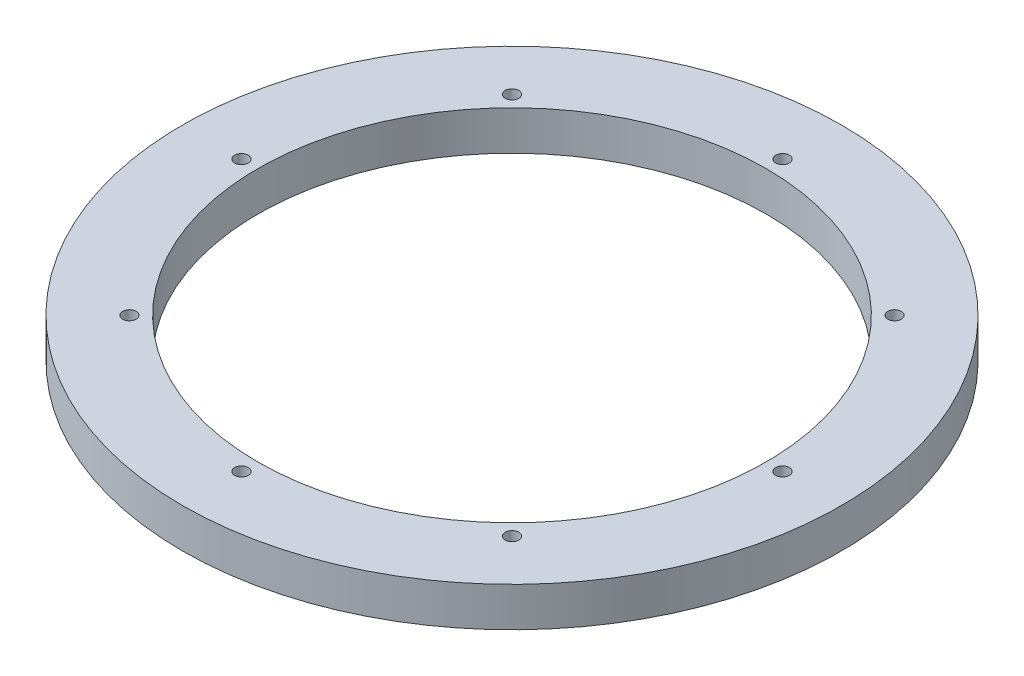
from build123d import *

# Parameters (mm, degrees)
SKETCH1_R           = 63.8175
SKETCH1_R_2         = 1.3208
SKETCH1_R_3         = 49.2125
BOSS_EXTRUDE1_DEPTH = 7.62


with BuildPart() as part:
    # Sketch1 → Boss-Extrude1 (new body)
    with BuildSketch(Plane(origin=(0, 0, 0), x_dir=(1, 0, 0), z_dir=(0, 1, 0))):
        Circle(SKETCH1_R)
        with Locations((37.043556499, 37.043556499)):
            Circle(SKETCH1_R_2, mode=Mode.SUBTRACT)
        with Locations((-37.043556499, -37.043556499)):
            Circle(SKETCH1_R_2, mode=Mode.SUBTRACT)
        with Locations((0, -52.3875)):
            Circle(SKETCH1_R_2, mode=Mode.SUBTRACT)
        with Locations((37.043556499, -37.043556499)):
            Circle(SKETCH1_R_2, mode=Mode.SUBTRACT)
        with Locations((-52.3875, 0)):
            Circle(SKETCH1_R_2, mode=Mode.SUBTRACT)
        with Locations((-37.043556499, 37.043556499)):
            Circle(SKETCH1_R_2, mode=Mode.SUBTRACT)
        Circle(SKETCH1_R_3, mode=Mode.SUBTRACT)
        with Locations((52.3875, 0)):
            Circle(SKETCH1_R_2, mode=Mode.SUBTRACT)
        with Locations((0, 52.3875)):
            Circle(SKETCH1_R_2, mode=Mode.SUBTRACT)
    extrude(amount=BOSS_EXTRUDE1_DEPTH)


solid = part.part
